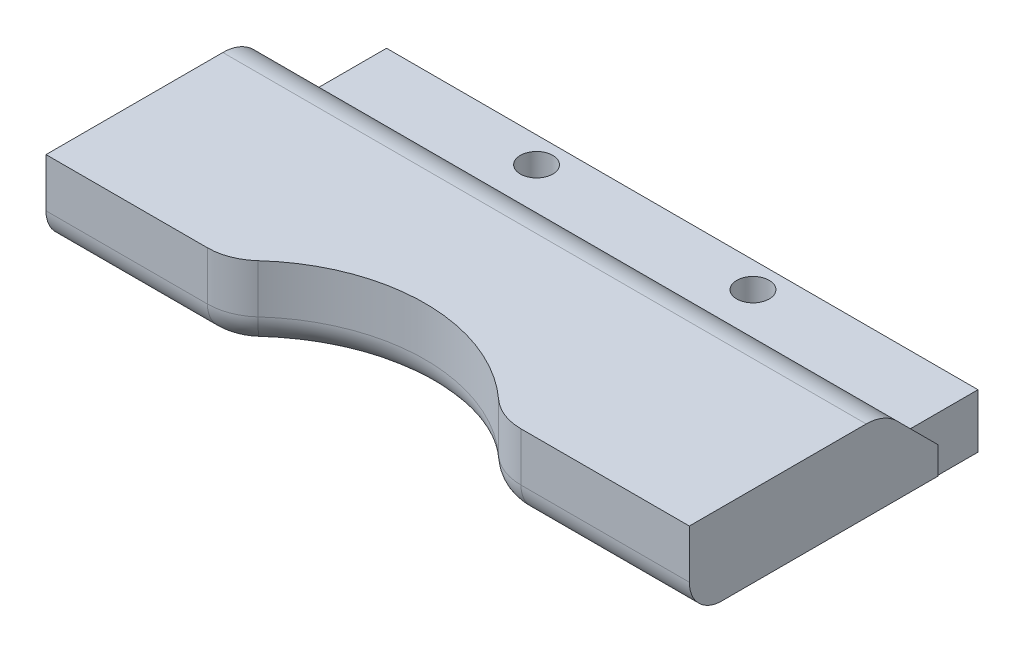
from build123d import *

# Parameters (mm, degrees)
SKETCH_1_W          = 54.664318292
SKETCH_1_H          = 5
SKETCH_1_R          = 1.5
EXTRUDE_1_DEPTH     = 5
SKETCH_2_W          = 59.460193076
SKETCH_2_H          = 2.500348526
EXTRUDE_2_DEPTH     = 23
SKETCH_5_R          = 16.5
CUT_EXTRUDE_1_DEPTH = 15
EXTRUDE_START       = 5
EXTRUDE_3_DEPTH     = 5
CHAMFER_1_SIZE      = 5
FILLET_6_R          = 10
FILLET_7_R          = 4
FILLET_8_R          = 5
FILLET_9_R          = 3


with BuildPart() as part:
    # 草图1 → 凸台-拉伸1 (new body)
    with BuildSketch(Plane(origin=(0, 0, 0), x_dir=(1, 0, 0), z_dir=(0, 1, 0))):
        with Locations((1.075531559, -8.61)):
            Rectangle(SKETCH_1_W, SKETCH_1_H)
        with Locations(Location((-10, -8.5, 0), (0, 0, 270))):
            Circle(SKETCH_1_R, mode=Mode.SUBTRACT)
        with Locations(Location((10, -8.5, 0), (0, 0, 90))):
            Circle(SKETCH_1_R, mode=Mode.SUBTRACT)
    extrude(amount=EXTRUDE_1_DEPTH)

    # 草图2 → 凸台-拉伸2 (add)
    with BuildSketch(Plane.XY.offset(11.11)):
        with Locations((0, 2.5)):
            Rectangle(SKETCH_2_W, SKETCH_2_H)
    extrude(amount=EXTRUDE_2_DEPTH)

    # 草图5 → 切除-拉伸1 (cut)
    with BuildSketch(Plane(origin=(0, 3.750174263, 0), x_dir=(1, 0, 0), z_dir=(0, 1, 0))):
        with Locations((-0.32, -44.994124541)):
            Circle(SKETCH_5_R)
    extrude(amount=-CUT_EXTRUDE_1_DEPTH, mode=Mode.SUBTRACT)

    # 草图7 → 凸台-拉伸3 (add)
    with BuildSketch(Plane(origin=(0, 3.750174263, 0), x_dir=(1, 0, 0), z_dir=(0, 1, 0)).offset(EXTRUDE_START)):
        with BuildLine():
            Line((29.730096538, -11.11), (28.407690705, -11.11))
            Line((28.407690705, -11.11), (-26.256627587, -11.11))
            Line((-26.256627587, -11.11), (-29.730096538, -11.11))
            Line((-29.730096538, -11.11), (-29.730096538, -34.11))
            Line((-29.730096538, -34.11), (-12.721041608, -34.11))
            ThreePointArc((-12.721041608, -34.11), (-0.32, -28.494124541), (12.081041608, -34.11))
            Line((12.081041608, -34.11), (29.730096538, -34.11))
            Line((29.730096538, -34.11), (29.730096538, -11.11))
        make_face()
    extrude(amount=-EXTRUDE_3_DEPTH)

    # 倒角1
    # the kernel refuses this chamfer: 5 mm, written as the material it takes off along each edge
    with BuildSketch(Plane(origin=(-42.588511478, 8.750174263, 11.11), x_dir=(0, -0.9996219169112968, -0.027495876610586317), z_dir=(1, 0, 0))) as chamfer_1_piece_1_section:
        Polygon((CHAMFER_1_SIZE * 0.999621916911, -CHAMFER_1_SIZE * 0.0274958766106), (-CHAMFER_1_SIZE * 0.0274958766106, -CHAMFER_1_SIZE * 0.999621916911), (0, 0), align=None)
    chamfer_1_piece_1 = extrude(amount=85.177022955, mode=Mode.PRIVATE)
    chamfer_1_piece_1 = split(chamfer_1_piece_1, bisect_by=Plane(origin=(-34.422569532, 5, 11.399404242), z_dir=(0, -1, 0)), keep=Keep.TOP, mode=Mode.PRIVATE)
    chamfer_1_piece_1 = split(chamfer_1_piece_1, bisect_by=Plane(origin=(-26.256627587, 4.506210637, 11.399404242), z_dir=(-1, 0, 0)), keep=Keep.TOP, mode=Mode.PRIVATE)
    add(chamfer_1_piece_1, mode=Mode.SUBTRACT)
    with BuildSketch(Plane(origin=(-42.588511478, 8.750174263, 11.11), x_dir=(0, -0.9996219169112968, -0.027495876610586317), z_dir=(1, 0, 0))) as chamfer_1_piece_2_section:
        Polygon((CHAMFER_1_SIZE * 0.999621916911, -CHAMFER_1_SIZE * 0.0274958766106), (-CHAMFER_1_SIZE * 0.0274958766106, -CHAMFER_1_SIZE * 0.999621916911), (0, 0), align=None)
    chamfer_1_piece_2 = extrude(amount=85.177022955, mode=Mode.PRIVATE)
    chamfer_1_piece_2 = split(chamfer_1_piece_2, bisect_by=Plane(origin=(-34.422569532, 5, 12.869772417), z_dir=(0, 1, 0)), keep=Keep.TOP, mode=Mode.PRIVATE)
    chamfer_1_piece_2 = split(chamfer_1_piece_2, bisect_by=Plane(origin=(-26.256627587, 7.312697929, 12.869772417), z_dir=(-1, 0, 0)), keep=Keep.TOP, mode=Mode.PRIVATE)
    add(chamfer_1_piece_2, mode=Mode.SUBTRACT)
    with BuildSketch(Plane(origin=(-42.588511478, 8.750174263, 11.11), x_dir=(0, -0.9996219169112968, -0.027495876610586317), z_dir=(1, 0, 0))) as chamfer_1_piece_3_section:
        Polygon((CHAMFER_1_SIZE * 0.999621916911, -CHAMFER_1_SIZE * 0.0274958766106), (-CHAMFER_1_SIZE * 0.0274958766106, -CHAMFER_1_SIZE * 0.999621916911), (0, 0), align=None)
    chamfer_1_piece_3 = extrude(amount=85.177022955, mode=Mode.PRIVATE)
    chamfer_1_piece_3 = split(chamfer_1_piece_3, bisect_by=Plane(origin=(1.075531559, 5, 12.869772417), z_dir=(0, 1, 0)), keep=Keep.TOP, mode=Mode.PRIVATE)
    chamfer_1_piece_3 = split(chamfer_1_piece_3, bisect_by=Plane(origin=(28.407690705, 7.312697929, 12.869772417), z_dir=(-1, 0, 0)), keep=Keep.TOP, mode=Mode.PRIVATE)
    chamfer_1_piece_3 = split(chamfer_1_piece_3, bisect_by=Plane(origin=(-26.256627587, 7.312697929, 12.869772417), z_dir=(1, 0, 0)), keep=Keep.TOP, mode=Mode.PRIVATE)
    add(chamfer_1_piece_3, mode=Mode.SUBTRACT)
    with BuildSketch(Plane(origin=(-42.588511478, 8.750174263, 11.11), x_dir=(0, -0.9996219169112968, -0.027495876610586317), z_dir=(1, 0, 0))) as chamfer_1_piece_4_section:
        Polygon((CHAMFER_1_SIZE * 0.999621916911, -CHAMFER_1_SIZE * 0.0274958766106), (-CHAMFER_1_SIZE * 0.0274958766106, -CHAMFER_1_SIZE * 0.999621916911), (0, 0), align=None)
    chamfer_1_piece_4 = extrude(amount=85.177022955, mode=Mode.PRIVATE)
    chamfer_1_piece_4 = split(chamfer_1_piece_4, bisect_by=Plane(origin=(35.498101091, 5, 11.399404242), z_dir=(0, -1, 0)), keep=Keep.TOP, mode=Mode.PRIVATE)
    chamfer_1_piece_4 = split(chamfer_1_piece_4, bisect_by=Plane(origin=(28.407690705, 4.506210637, 11.399404242), z_dir=(1, 0, 0)), keep=Keep.TOP, mode=Mode.PRIVATE)
    add(chamfer_1_piece_4, mode=Mode.SUBTRACT)
    with BuildSketch(Plane(origin=(-42.588511478, 8.750174263, 11.11), x_dir=(0, -0.9996219169112968, -0.027495876610586317), z_dir=(1, 0, 0))) as chamfer_1_piece_5_section:
        Polygon((CHAMFER_1_SIZE * 0.999621916911, -CHAMFER_1_SIZE * 0.0274958766106), (-CHAMFER_1_SIZE * 0.0274958766106, -CHAMFER_1_SIZE * 0.999621916911), (0, 0), align=None)
    chamfer_1_piece_5 = extrude(amount=85.177022955, mode=Mode.PRIVATE)
    chamfer_1_piece_5 = split(chamfer_1_piece_5, bisect_by=Plane(origin=(35.498101091, 5, 12.869772417), z_dir=(0, 1, 0)), keep=Keep.TOP, mode=Mode.PRIVATE)
    chamfer_1_piece_5 = split(chamfer_1_piece_5, bisect_by=Plane(origin=(28.407690705, 7.312697929, 12.869772417), z_dir=(1, 0, 0)), keep=Keep.TOP, mode=Mode.PRIVATE)
    add(chamfer_1_piece_5, mode=Mode.SUBTRACT)

    # 圆角6
    # the kernel refuses this fillet: 10 mm, written as the material it adds along each edge
    with BuildSketch(Plane(origin=(28.407690705, 1.249825737, 11.11), x_dir=(0, 0, 1), z_dir=(-1, 0, 0))) as fillet_6_piece_1:
        with BuildLine():
            CenterArc((4.840914208, -10), FILLET_6_R, 90, 28.952961909)
            Line((0, -1.249825737), (0, 0))
            Line((0, 0), (4.840914208, 0))
        make_face()
    extrude(amount=54.664318292)

    # 圆角7
    fillet_7_edges = [part.edges().sort_by_distance(p)[0] for p in [
        (0, 8.750174263, 16.11),
    ]]
    fillet(fillet_7_edges, radius=FILLET_7_R)

    # 圆角8
    fillet_8_edges = [part.edges().sort_by_distance(p)[0] for p in [
        (-12.721041608, 5, 34.11),
        (12.081041608, 5, 34.11),
    ]]
    fillet(fillet_8_edges, radius=FILLET_8_R)

    # 圆角9
    fillet_9_edges = [part.edges().sort_by_distance(p)[0] for p in [
        (-0.32, 1.249825737, 28.494124541),
        (21.949780623, 1.249825737, 34.11),
        (12.362521469, 1.249825737, 33.772076375),
        (-13.002521469, 1.249825737, 33.772076375),
        (-22.269780623, 1.249825737, 34.11),
    ]]
    fillet(fillet_9_edges, radius=FILLET_9_R)


solid = part.part
